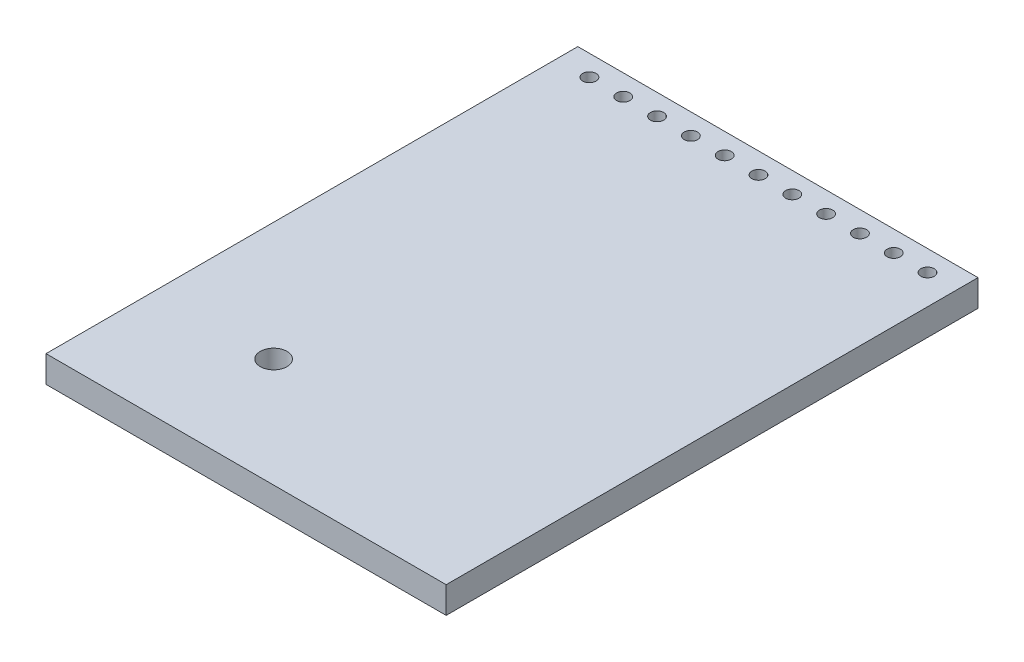
from build123d import *

# Parameters (mm, degrees)
SKETCH1_W           = 30.06
SKETCH1_H           = 2
BOSS_EXTRUDE1_DEPTH = 39.95
SKETCH2_R           = 1
CUT_EXTRUDE1_DEPTH  = 39.95
SKETCH3_R           = 0.5
CUT_EXTRUDE2_DEPTH  = 4.5
LPATTERN1_COUNT     = 11
LPATTERN1_PITCH     = 2.54


with BuildPart() as part:
    # Sketch1 → Boss-Extrude1 (new body)
    with BuildSketch(Plane.XY):
        with Locations((15.03, 1)):
            Rectangle(SKETCH1_W, SKETCH1_H)
    extrude(amount=BOSS_EXTRUDE1_DEPTH)

    # Sketch2 → Cut-Extrude1 (cut)
    with BuildSketch(Plane(origin=(0, 2, 0), x_dir=(1, 0, 0), z_dir=(0, 1, 0))):
        with Locations((8.9, -31.75)):
            Circle(SKETCH2_R)
    extrude(amount=-CUT_EXTRUDE1_DEPTH, mode=Mode.SUBTRACT)

    # Sketch3 → Cut-Extrude2 (cut)
    with BuildSketch(Plane(origin=(0, 2, 0), x_dir=(1, 0, 0), z_dir=(0, 1, 0))):
        with Locations((27.83, -1.56)):
            Circle(SKETCH3_R)
    cut_extrude2 = extrude(amount=-CUT_EXTRUDE2_DEPTH, mode=Mode.SUBTRACT)

    # LPattern1: Cut-Extrude2 ×11
    with Locations(*[(-i * LPATTERN1_PITCH, 0, 0) for i in range(1, LPATTERN1_COUNT)]):
        add(cut_extrude2, mode=Mode.SUBTRACT)


solid = part.part
